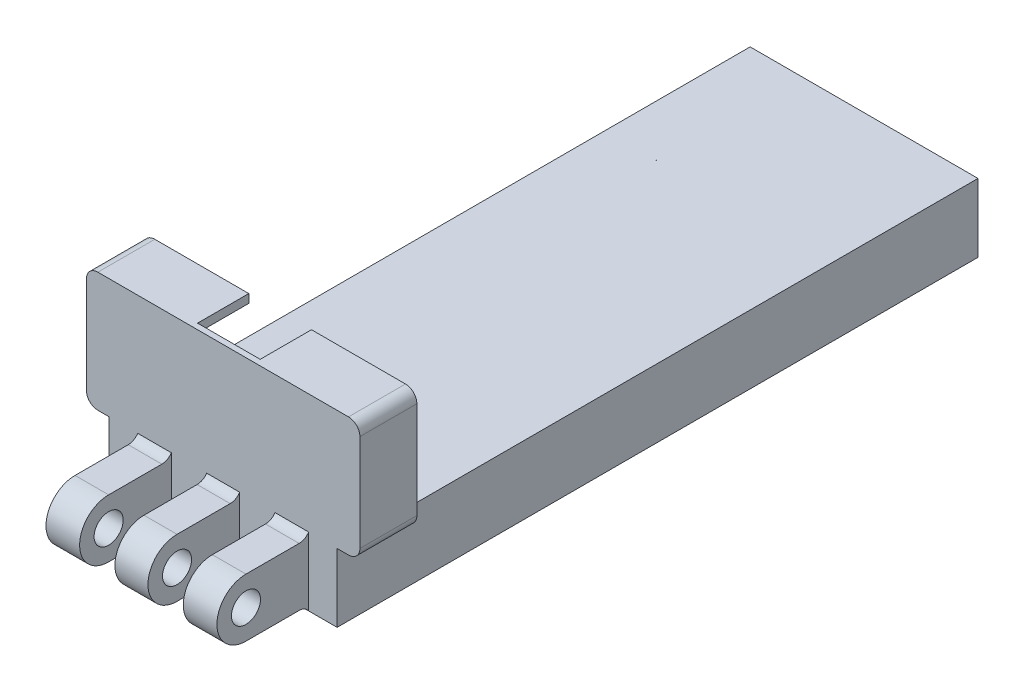
from build123d import *

# Parameters (mm, degrees)
BOSS_EXTRUDE1_DEPTH      = 1
BOSS_EXTRUDE1_DEPTH_BACK = 112
SKETCH1_W                = 40
SKETCH1_H                = 12
SKETCH1_R                = 4.25
SKETCH3_R                = 2.55
BOSS_EXTRUDE2_DEPTH      = 15
CUT_EXTRUDE1_START       = -2.9
SKETCH3_2_R              = 2.55
CUT_EXTRUDE1_DEPTH       = 6.2
BOSS_EXTRUDE3_START      = -3
SKETCH5_R                = 4.25
BOSS_EXTRUDE3_DEPTH      = 3
CHAMFER3_SIZE            = 0.5
FILLET3_R                = 2
SKETCH12_R               = 4.05
BOSS_EXTRUDE9_DEPTH      = 100
SKETCH18_W               = 48
SKETCH18_H               = 21
BOSS_EXTRUDE11_DEPTH     = 10
FILLET10_R               = 2
CUT_EXTRUDE8_DEPTH       = 9
BOSS_EXTRUDE12_DEPTH     = 13


with BuildPart() as part:
    # Sketch1 → Boss-Extrude1 (new, two sides: drawn at the far end of the back side and taken through both)
    with BuildSketch(Plane.XY.offset(-BOSS_EXTRUDE1_DEPTH_BACK)):
        Rectangle(SKETCH1_W, SKETCH1_H)
        with Locations((11, 0)):
            Circle(SKETCH1_R, mode=Mode.SUBTRACT)
        with Locations(Location((-11, 0, 0), (0, 0, 180))):
            Circle(SKETCH1_R, mode=Mode.SUBTRACT)
    extrude(amount=BOSS_EXTRUDE1_DEPTH + BOSS_EXTRUDE1_DEPTH_BACK)

    # Sketch3 → Boss-Extrude2 (add, symmetric)
    with BuildSketch(Plane(origin=(0, 0, 0), x_dir=(0, 0, -1), z_dir=(1, 0, 0))):
        with BuildLine():
            Line((-12, -5.1), (-1, -5.1))
            Line((-1, -5.1), (-1, 5.1))
            Line((-1, 5.1), (-12, 5.1))
            ThreePointArc((-12, 5.1), (-17.1, 0), (-12, -5.1))
        make_face()
        with Locations((-12, 0)):
            Circle(SKETCH3_R, mode=Mode.SUBTRACT)
    extrude(amount=BOSS_EXTRUDE2_DEPTH, both=True)

    # Sketch3<2> → Cut-Extrude1 (cut)
    with BuildSketch(Plane(origin=(0, 0, 0), x_dir=(0, 0, -1), z_dir=(1, 0, 0)).offset(CUT_EXTRUDE1_START)):
        with BuildLine():
            Line((-12, -5.1), (-1, -5.1))
            Line((-1, -5.1), (-1, 5.1))
            Line((-1, 5.1), (-12, 5.1))
            ThreePointArc((-12, 5.1), (-17.1, 0), (-12, -5.1))
        make_face()
        with Locations((-12, 0)):
            Circle(SKETCH3_2_R, mode=Mode.SUBTRACT)
    cut_extrude1 = extrude(amount=-CUT_EXTRUDE1_DEPTH, mode=Mode.SUBTRACT)

    # Mirror1: Cut-Extrude1 across plane
    add(cut_extrude1.mirror(Plane(origin=(0, 0, 0), x_dir=(0, 0, 1), z_dir=(1, 0, 0))), mode=Mode.SUBTRACT)

    # Sketch5 → Boss-Extrude3 (add)
    with BuildSketch(Plane.XY.offset(1).offset(BOSS_EXTRUDE3_START)):
        with Locations((-11, 0)):
            Circle(SKETCH5_R)
        with Locations((11, 0)):
            Circle(SKETCH5_R)
    extrude(amount=BOSS_EXTRUDE3_DEPTH)

    # Chamfer3
    chamfer3_edges = [part.edges().sort_by_distance(p)[0] for p in [
        (6.75, 0, -112),
        (-20, 0, -112),
        (-6.75, 0, -112),
        (0, -6, -112),
        (20, 0, -112),
        (0, 6, -112),
    ]]
    chamfer(chamfer3_edges, length=CHAMFER3_SIZE)

    # Fillet3
    # the kernel refuses this fillet: 2 mm, written as the material it adds along each edge
    with BuildSketch(Plane(origin=(9.1, -5.1, 1), x_dir=(0, -1.0, 1.5367953823073576e-12), z_dir=(1, 0, 0)), Plane(origin=(-15, -5.1, 1), x_dir=(0, -1.0, 1.5367953823073576e-12), z_dir=(1, 0, 0))) as fillet3_piece_1:
        with BuildLine():
            CenterArc((2, -1.670329309), FILLET3_R, 123.367012969, 56.632987031)
            Line((0, -1.670329309), (-0.04, -1.670329309))
            Line((-0.04, -1.670329309), (-0.04, 0))
            Line((-0.04, 0), (0, 0.04))
            ThreePointArc((0, 0.04), (0.45, 0.04), (0.878, 0.033406586))
            Line((0.878, 0.033406586), (0.9, 0))
        make_face()
    extrude(amount=5.9)
    with BuildSketch(Plane(origin=(9.1, 5.1, 1), x_dir=(0, 1.0, 1.5343282200304168e-12), z_dir=(1, 0, 0)), Plane(origin=(-15, 5.1, 1), x_dir=(0, 1.0, 1.5340815038027225e-12), z_dir=(1, 0, 0))) as fillet3_piece_2:
        with BuildLine():
            CenterArc((2, 1.670329309), FILLET3_R, 180, 56.632987031)
            Line((0, 1.670329309), (-0.04, 1.670329309))
            Line((-0.04, 1.670329309), (-0.04, 0))
            Line((-0.04, 0), (0, -0.04))
            ThreePointArc((0, -0.04), (0.45, -0.04), (0.878, -0.033406586))
            Line((0.878, -0.033406586), (0.9, 0))
        make_face()
    extrude(amount=5.9)
    with BuildSketch(Plane(origin=(-2.9, 5.1, 1), x_dir=(0, 1.0, 1.5343282200304168e-12), z_dir=(1, 0, 0))) as fillet3_piece_3:
        with BuildLine():
            CenterArc((2, 1.670329309), FILLET3_R, 180, 56.632987031)
            Line((0, 1.670329309), (-0.04, 1.670329309))
            Line((-0.04, 1.670329309), (-0.04, 0))
            Line((-0.04, 0), (0, -0.04))
            ThreePointArc((0, -0.04), (0.45, -0.04), (0.878, -0.033406586))
            Line((0.878, -0.033406586), (0.9, 0))
        make_face()
    extrude(amount=5.8)
    with BuildSketch(Plane(origin=(-2.9, -5.1, 1), x_dir=(0, -1.0, 1.5367953823073576e-12), z_dir=(1, 0, 0))) as fillet3_piece_4:
        with BuildLine():
            CenterArc((2, -1.670329309), FILLET3_R, 123.367012969, 56.632987031)
            Line((0, -1.670329309), (-0.04, -1.670329309))
            Line((-0.04, -1.670329309), (-0.04, 0))
            Line((-0.04, 0), (0, 0.04))
            ThreePointArc((0, 0.04), (0.45, 0.04), (0.878, 0.033406586))
            Line((0.878, 0.033406586), (0.9, 0))
        make_face()
    extrude(amount=5.8)

    # Sketch12 → Boss-Extrude9 (add)
    with BuildSketch(Plane(origin=(0, 0, 1), x_dir=(-1, 0, 0), z_dir=(0, 0, -1))):
        with Locations(Location((11, 0, 0), (0, 0, 180))):
            Circle(SKETCH12_R)
        with Locations(Location((-11, 0, 0), (0, 0, 180))):
            Circle(SKETCH12_R)
    extrude(amount=BOSS_EXTRUDE9_DEPTH)

    # Sketch18 → Boss-Extrude11 (add)
    with BuildSketch(Plane(origin=(0, 0, 1), x_dir=(-1, 0, 0), z_dir=(0, 0, -1))):
        with Locations((0, 16.5)):
            Rectangle(SKETCH18_W, SKETCH18_H)
    extrude(amount=BOSS_EXTRUDE11_DEPTH)

    # Fillet10
    fillet10_edges = [part.edges().sort_by_distance(p)[0] for p in [
        (-24, 6, -4),
        (-24, 27, -4),
        (24, 27, -4),
        (24, 6, -4),
    ]]
    fillet(fillet10_edges, radius=FILLET10_R)

    # Sketch20 → Cut-Extrude8 (cut)
    with BuildSketch(Plane(origin=(0, 0, -9), x_dir=(-1, 0, 0), z_dir=(0, 0, -1))):
        with BuildLine():
            Line((-22.5, 24.5), (-22.5, 6))
            Line((-22.5, 6), (22.5, 6))
            Line((22.5, 6), (22.5, 24.5))
            ThreePointArc((22.5, 24.5), (22.207106781, 25.207106781), (21.5, 25.5))
            Line((21.5, 25.5), (5.5, 25.5))
            Line((5.5, 25.5), (5.5, 27))
            Line((5.5, 27), (-5.5, 27))
            Line((-5.5, 27), (-5.5, 25.5))
            Line((-5.5, 25.5), (-21.5, 25.5))
            ThreePointArc((-21.5, 25.5), (-22.207106781, 25.207106781), (-22.5, 24.5))
        make_face()
    extrude(amount=-CUT_EXTRUDE8_DEPTH, mode=Mode.SUBTRACT)

    # Sketch22 → Boss-Extrude12 (add)
    with BuildSketch(Plane(origin=(0, 0, -99), x_dir=(-1, 0, 0), z_dir=(0, 0, -1))):
        with BuildLine():
            Line((15.75, 0), (6.25, 0))
            ThreePointArc((6.25, 0), (11, -4.75), (15.75, 0))
        make_face()
        with BuildLine():
            Line((-6.25, 0), (-15.75, 0))
            ThreePointArc((-15.75, 0), (-11, -4.75), (-6.25, 0))
        make_face()
    extrude(amount=BOSS_EXTRUDE12_DEPTH)


solid = part.part
